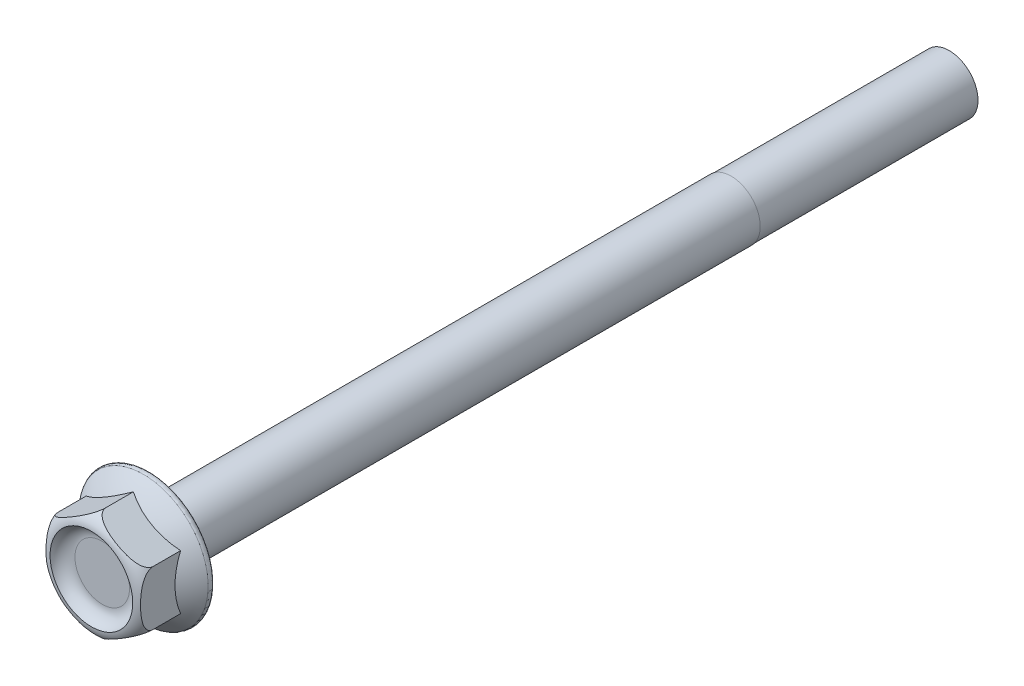
from build123d import *

# Parameters (mm, degrees)
HEAD_DEPTH     = 8
SHANK_SKETCH_R = 4
SHANK_DEPTH    = 110
SKETCH6_R      = 5.6875
HEAD_CUT_DEPTH = 1.5
FILLET1_R      = 2
FILLET2_R      = 0.5
THREAD_END_W   = 30
THREAD_END_H   = 0.05


with BuildPart() as part:
    # Head Sketch → Head (new body)
    with BuildSketch(Plane.XY):
        Polygon((0, 7.505553499), (6.5, 3.75277675), (6.5, -3.75277675), (0, -7.505553499), (-6.5, -3.75277675), (-6.5, 3.75277675), align=None)
    extrude(amount=HEAD_DEPTH)

    # Shank Sketch → Shank (add)
    with BuildSketch(Plane.XY):
        Circle(SHANK_SKETCH_R)
    extrude(amount=-SHANK_DEPTH)

    # Sketch3 → Flange (revolve)
    with BuildSketch(Plane(origin=(0, 0, 0), x_dir=(-1, 0, 0), z_dir=(0, 1, 0)), mode=Mode.PRIVATE) as flange_sk:
        with BuildLine():
            Line((-8.5, 0), (0, 0))
            Line((0, 0), (0, 5))
            ThreePointArc((0, 5), (-4.909972075, 3.90244066), (-8.885269122, 0.818696884))
            ThreePointArc((-8.885269122, 0.818696884), (-8.952409351, 0.287101482), (-8.5, 0))
        make_face()
    revolve(flange_sk.sketch.rotate(Axis((0, 0, 0), (0, 0, 1)), 30), axis=Axis((0, 0, 0), (0, 0, 1)))

    # Sketch5 → Head Trim (revolve, cut)
    with BuildSketch(Plane(origin=(0, 0, 0), x_dir=(0, 0, -1), z_dir=(1, 0, 0)), mode=Mode.PRIVATE) as head_trim_sk:
        with BuildLine():
            Line((-8, -5.505553499), (-8, -7.505553499))
            Line((-8, -7.505553499), (-6, -7.505553499))
            ThreePointArc((-6, -7.505553499), (-7.414213562, -6.919767062), (-8, -5.505553499))
        make_face()
    revolve(head_trim_sk.sketch.rotate(Axis((0, 0, 15.085599173), (0, 0, -1)), 90), axis=Axis((0, 0, 15.085599173), (0, 0, -1)), mode=Mode.SUBTRACT)

    # Sketch6 → Head Cut (cut)
    with BuildSketch(Plane.XY.offset(8)):
        Circle(SKETCH6_R)
    extrude(amount=-HEAD_CUT_DEPTH, mode=Mode.SUBTRACT)

    # Fillet1
    # the kernel refuses this fillet: 2 mm, written as the material it adds along each edge
    with BuildSketch(Plane(origin=(0, 0, 6.5), x_dir=(1, 0, 0), z_dir=(0, -1, 0))) as fillet1_piece_1:
        with BuildLine():
            CenterArc((3.753168618, 2), FILLET1_R, 270, 75.276973149)
            Line((3.753168618, 0), (3.753168618, -0.04))
            Line((3.753168618, -0.04), (5.6875, -0.04))
            Line((5.6875, -0.04), (5.7275, 0))
            ThreePointArc((5.7275, 0), (5.7275, 0.745853336), (5.726186628, 1.481540806))
            Line((5.726186628, 1.481540806), (5.6875, 1.491706673))
        make_face()
    revolve(axis=Axis((0, 0, 6.5), (0, 0, 1)), revolution_arc=180.000000894)
    with BuildSketch(Plane(origin=(0, 0, 6.5), x_dir=(-0.9999999999999999, -1.560445893577358e-08, 0), z_dir=(-1.560445893577358e-08, 0.9999999999999999, 0))) as fillet1_piece_2:
        with BuildLine():
            CenterArc((3.753168618, 2), FILLET1_R, 270, 75.276973149)
            Line((3.753168618, 0), (3.753168618, -0.04))
            Line((3.753168618, -0.04), (5.6875, -0.04))
            Line((5.6875, -0.04), (5.7275, 0))
            ThreePointArc((5.7275, 0), (5.7275, 0.745853336), (5.726186628, 1.481540806))
            Line((5.726186628, 1.481540806), (5.6875, 1.491706673))
        make_face()
    revolve(axis=Axis((0, 0, 6.5), (0, 0, 1)), revolution_arc=179.999999106)

    # Fillet2
    fillet2_edges = [part.edges().sort_by_distance(p)[0] for p in [
        (-4, 0, 0),
    ]]
    fillet(fillet2_edges, radius=FILLET2_R)

    # Thread End → Thread Cut (revolve, cut)
    with BuildSketch(Plane(origin=(0, 0, 0), x_dir=(0, 0, -1), z_dir=(1, 0, 0)), mode=Mode.PRIVATE) as thread_cut_sk:
        with Locations((95, 3.975)):
            Rectangle(THREAD_END_W, THREAD_END_H)
    revolve(thread_cut_sk.sketch.rotate(Axis((0, 0, -21.551935625), (0, 0, -1)), 60.000022404), axis=Axis((0, 0, -21.551935625), (0, 0, -1)), mode=Mode.SUBTRACT)


solid = part.part
